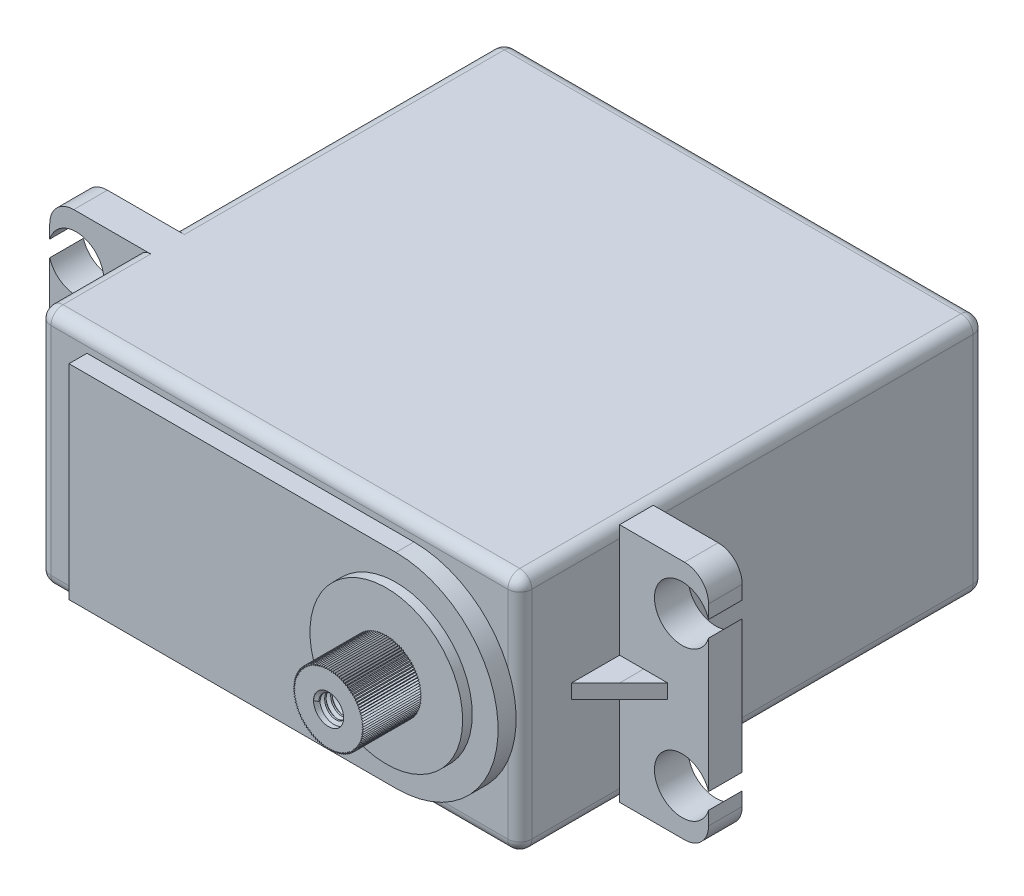
from build123d import *
from build123d.topology import SkipClean

# Parameters (mm, degrees)
SKETCH1_W            = 40
SKETCH1_H            = 20
BOSS_EXTRUDE1_DEPTH  = 38.7
SKETCH2_W            = 2.8
SKETCH2_H            = 20
BOSS_EXTRUDE2_DEPTH  = 7.4
SKETCH3_R            = 2.3
CUT_EXTRUDE1_DEPTH   = 43.129799
FILLET1_R            = 2
RIB5_OUTLINE_W       = 4
RIB5_OUTLINE_H       = 1.2
RIB5_DEPTH           = 4
CUT_EXTRUDE2_DEPTH   = 49.588167
SKETCH6_W            = 3.7
SKETCH6_H            = 6.3
BOSS_EXTRUDE3_DEPTH  = 5
FILLET3_R            = 1
BOSS_EXTRUDE4_DEPTH  = 1.5
SKETCH8_R            = 6.35
BOSS_EXTRUDE5_DEPTH  = 0.8
BOSS_EXTRUDE6_DEPTH  = 4.8
SKETCH10_R           = 1.25
CUT_EXTRUDE3_DEPTH   = 6
THREAD1_PITCH        = 0.5
FILLET1_OF_MIRROR1_R = 2


# Read off the part's stored shape, not the designer's step: Rib5
with BuildPart() as part:
    # Sketch1 → Boss-Extrude1 (new body)
    with BuildSketch(Plane.XY):
        Rectangle(SKETCH1_W, SKETCH1_H)
    extrude(amount=BOSS_EXTRUDE1_DEPTH)

    # Sketch2 → Boss-Extrude2 (add)
    with BuildSketch(Plane.ZY.offset(20)):
        with Locations((29, 0)):
            Rectangle(SKETCH2_W, SKETCH2_H)
    boss_extrude2 = extrude(amount=BOSS_EXTRUDE2_DEPTH)

    # Sketch3 → Cut-Extrude1 (cut, through all)
    with BuildSketch(Plane.XY.offset(30.4)):
        with Locations((-25.2, 6.2)):
            Circle(SKETCH3_R)
        with Locations((-25.2, -6.2)):
            Circle(SKETCH3_R)
    cut_extrude1 = extrude(amount=-CUT_EXTRUDE1_DEPTH, mode=Mode.SUBTRACT)

    # Fillet1
    fillet1_edges = [part.edges().sort_by_distance(p)[0] for p in [
        (-27.4, -10, 29),
        (-27.4, 10, 29),
    ]]
    fillet(fillet1_edges, radius=FILLET1_R)

    # Rib5 outline → Rib5 (add)
    with BuildSketch(Plane.XY.offset(30.4)):
        with Locations((-22, 0)):
            Rectangle(RIB5_OUTLINE_W, RIB5_OUTLINE_H)
    rib5 = extrude(amount=RIB5_DEPTH)

    # Sketch5 → Cut-Extrude2 (cut, through all)
    with BuildSketch(Plane.XZ.offset(0.6)):
        Polygon((-24, 34.4), (-24, 30.4), (-20, 34.4), align=None)
    cut_extrude2 = extrude(amount=-CUT_EXTRUDE2_DEPTH, mode=Mode.SUBTRACT)

    # Sketch6 → Boss-Extrude3 (add)
    with BuildSketch(Plane.ZY.offset(20)):
        with Locations((4.098205, 0)):
            Rectangle(SKETCH6_W, SKETCH6_H)
    extrude(amount=BOSS_EXTRUDE3_DEPTH)

    # Fillet3
    fillet3_edges = [part.edges().sort_by_distance(p)[0] for p in [
        (-20, 0, 5.948205),
        (-22.5, -3.15, 5.948205),
        (-20, 3.15, 4.098205),
        (-22.5, 3.15, 5.948205),
        (-20, 0, 2.248205),
        (-22.5, 3.15, 2.248205),
        (-20, -3.15, 4.098205),
        (-22.5, -3.15, 2.248205),
        (-25, 0, 5.948205),
        (-25, 3.15, 4.098205),
        (-25, 0, 2.248205),
        (-25, -3.15, 4.098205),
        (-20, 0, 38.7),
        (-20, -10, 13.8),
        (-20, 10, 13.8),
        (0, -10, 38.7),
        (20, 0, 38.7),
        (0, -10, 0),
        (-20, 0, 0),
        (0, 10, 0),
        (20, 0, 0),
        (20, -10, 19.35),
        (-20, -10, 34.55),
        (-20, 10, 34.55),
        (20, 10, 19.35),
        (0, 10, 38.7),
    ]]
    fillet(fillet3_edges, radius=FILLET3_R)

    # Sketch7 → Boss-Extrude4 (add)
    with BuildSketch(Plane.XY.offset(38.7)):
        with BuildLine():
            Line((-16, 8.5), (11.194571, 8.5))
            ThreePointArc((11.194571, 8.5), (19.694571, 0), (11.194571, -8.5))
            Line((11.194571, -8.5), (-16, -8.5))
            Line((-16, -8.5), (-16, 8.5))
        make_face()
    extrude(amount=BOSS_EXTRUDE4_DEPTH)

    # Sketch8 → Boss-Extrude5 (add)
    with BuildSketch(Plane.XY.offset(40.2)):
        with Locations((11.194571, 0)):
            Circle(SKETCH8_R)
    extrude(amount=BOSS_EXTRUDE5_DEPTH)

    # Sketch9 → Boss-Extrude6 (add)
    with BuildSketch(Plane.XY.offset(41)):
        Polygon((11.194571, 2.941835), (11.107151, 2.798635), (11.010911, 2.936063), (10.932655, 2.787657), (10.827976, 2.918771), (10.759192, 2.765743), (10.646487, 2.890026), (10.587448, 2.732981), (10.467162, 2.849942), (10.4181, 2.6895), (10.290707, 2.798677), (10.251816, 2.635471), (10.117819, 2.736434), (10.089253, 2.571108), (9.949181, 2.663457), (9.931052, 2.496664), (9.785458, 2.580036), (9.777838, 2.412434), (9.627296, 2.486499), (9.630215, 2.318749), (9.475319, 2.383216), (9.488766, 2.215981), (9.330128, 2.270594), (9.354048, 2.104533), (9.192294, 2.149078), (9.226595, 1.984846), (9.062363, 2.019146), (9.106908, 1.857392), (8.940846, 1.881313), (8.99546, 1.722675), (8.828224, 1.736121), (8.892691, 1.581226), (8.724941, 1.584144), (8.799006, 1.433602), (8.631404, 1.425982), (8.714776, 1.280388), (8.547983, 1.262259), (8.640332, 1.122187), (8.475007, 1.093621), (8.575969, 0.959624), (8.412763, 0.920733), (8.52194, 0.79334), (8.361499, 0.744279), (8.478459, 0.623992), (8.321415, 0.564953), (8.445697, 0.452248), (8.29267, 0.383465), (8.423784, 0.278786), (8.275377, 0.20053), (8.412805, 0.10429), (8.269605, 0.016869), (8.412805, -0.070551), (8.275377, -0.166791), (8.423784, -0.245047), (8.29267, -0.349726), (8.445697, -0.418509), (8.321415, -0.531214), (8.478459, -0.590254), (8.361499, -0.71054), (8.52194, -0.759602), (8.412763, -0.886995), (8.575969, -0.925885), (8.475007, -1.059882), (8.640332, -1.088448), (8.547983, -1.22852), (8.714776, -1.246649), (8.631404, -1.392243), (8.799006, -1.399864), (8.724941, -1.550406), (8.892691, -1.547487), (8.828224, -1.702382), (8.99546, -1.688936), (8.940846, -1.847574), (9.106908, -1.823653), (9.062363, -1.985407), (9.226595, -1.951107), (9.192294, -2.115339), (9.354048, -2.070794), (9.330128, -2.236855), (9.488766, -2.182242), (9.475319, -2.349477), (9.630215, -2.285011), (9.627296, -2.452761), (9.777838, -2.378695), (9.785458, -2.546297), (9.931052, -2.462925), (9.949181, -2.629719), (10.089253, -2.537369), (10.117819, -2.702695), (10.251816, -2.601732), (10.290707, -2.764938), (10.4181, -2.655761), (10.467162, -2.816203), (10.587448, -2.699242), (10.646487, -2.856287), (10.759192, -2.732004), (10.827976, -2.885032), (10.932655, -2.753918), (11.010911, -2.902324), (11.107151, -2.764896), (11.194571, -2.908096), (11.281992, -2.764896), (11.378231, -2.902324), (11.456488, -2.753918), (11.561166, -2.885032), (11.62995, -2.732004), (11.742655, -2.856287), (11.801694, -2.699242), (11.92198, -2.816203), (11.971042, -2.655761), (12.098435, -2.764938), (12.137326, -2.601732), (12.271323, -2.702695), (12.299889, -2.537369), (12.439961, -2.629719), (12.45809, -2.462925), (12.603684, -2.546297), (12.611304, -2.378695), (12.761846, -2.452761), (12.758927, -2.285011), (12.913823, -2.349477), (12.900376, -2.182242), (13.059014, -2.236855), (13.035094, -2.070794), (13.196848, -2.115339), (13.162547, -1.951107), (13.326779, -1.985407), (13.282234, -1.823653), (13.448296, -1.847574), (13.393682, -1.688936), (13.560918, -1.702382), (13.496451, -1.547487), (13.664201, -1.550406), (13.590136, -1.399864), (13.757738, -1.392243), (13.674366, -1.246649), (13.841159, -1.22852), (13.74881, -1.088448), (13.914135, -1.059882), (13.813173, -0.925885), (13.976379, -0.886995), (13.867202, -0.759602), (14.027643, -0.71054), (13.910683, -0.590254), (14.067727, -0.531214), (13.943445, -0.418509), (14.096472, -0.349726), (13.965358, -0.245047), (14.113765, -0.166791), (13.976337, -0.070551), (14.119537, 0.016869), (13.976337, 0.10429), (14.113765, 0.20053), (13.965358, 0.278786), (14.096472, 0.383465), (13.943445, 0.452248), (14.067727, 0.564953), (13.910683, 0.623992), (14.027643, 0.744279), (13.867202, 0.79334), (13.976379, 0.920733), (13.813173, 0.959624), (13.914135, 1.093621), (13.74881, 1.122187), (13.841159, 1.262259), (13.674366, 1.280388), (13.757738, 1.425982), (13.590136, 1.433602), (13.664201, 1.584144), (13.496451, 1.581226), (13.560918, 1.736121), (13.393682, 1.722675), (13.448296, 1.881313), (13.282234, 1.857392), (13.326779, 2.019146), (13.162547, 1.984846), (13.196848, 2.149078), (13.035094, 2.104533), (13.059014, 2.270594), (12.900376, 2.215981), (12.913823, 2.383216), (12.758927, 2.318749), (12.761846, 2.486499), (12.611304, 2.412434), (12.603684, 2.580036), (12.45809, 2.496664), (12.439961, 2.663457), (12.299889, 2.571108), (12.271323, 2.736434), (12.137326, 2.635471), (12.098435, 2.798677), (11.971042, 2.6895), (11.92198, 2.849942), (11.801694, 2.732981), (11.742655, 2.890026), (11.62995, 2.765743), (11.561166, 2.918771), (11.456488, 2.787657), (11.378231, 2.936063), (11.281992, 2.798635), align=None)
    extrude(amount=BOSS_EXTRUDE6_DEPTH)

    # Sketch10 → Cut-Extrude3 (cut)
    with BuildSketch(Plane.XY.offset(45.8)):
        with Locations((11.194571, 0)):
            Circle(SKETCH10_R)
    extrude(amount=-CUT_EXTRUDE3_DEPTH, mode=Mode.SUBTRACT)

    # Thread1: the profile of Thread Profile1 profile screwed along a right-hand helix of 12 turns, 6 arcs to a turn; built about Z, then put on its axis
    with SkipClean():  # the faces are left unmerged after this step: merging them gives an invalid solid
        thread1_z = Axis((0, 0, 0), (0, 0, 1))
        thread1_corners = [(1.2503, 0, -0.000173), (1.2503, 0, 0.437673), (0.979367, 0, 0.28125), (0.979367, 0, 0.15625)]
        with BuildLine(mode=Mode.PRIVATE) as thread1_profile:
            Line(thread1_corners[0], thread1_corners[1])
            Line(thread1_corners[1], thread1_corners[2])
            Line(thread1_corners[2], thread1_corners[3])
            Line(thread1_corners[3], thread1_corners[0])
        thread1_cap = Face(thread1_profile.wire())
        thread1_turn_angles = [0, 30, 60, 90, 120, 150, 180, 210, 240, 270, 300, 330, 360]
        thread1_turn_weights = [1, 0.8660254037844387, 1, 0.8660254037844387, 1, 0.8660254037844387, 1, 0.8660254037844387, 1, 0.8660254037844387, 1, 0.8660254037844387, 1]
        thread1_turn_rails = [Edge.make_bspline([Vector(p[0], p[1], 0).rotate(thread1_z, thread1_turn_angles[k]) / thread1_turn_weights[k] + Vector(0, 0, p[2] + THREAD1_PITCH * thread1_turn_angles[k] / 360) for k in range(13)], [0, 0, 0, 1, 1, 2, 2, 3, 3, 4, 4, 5, 5, 6, 6, 6], 2, thread1_turn_weights) for p in thread1_corners]
        thread1_turn_sides = [Face.make_surface_from_curves(thread1_turn_rails[p[0]], thread1_turn_rails[p[1]]) for p in [(0, 1), (1, 2), (2, 3), (3, 0)]]
        thread1 = Plane(origin=(11.194571, 0, 45.8), x_dir=(-1, 0, 0), z_dir=(0, 0, -1)) * Solid(Shell([*[p.moved(Location((0, 0, THREAD1_PITCH * i))) for i in range(12) for p in thread1_turn_sides], thread1_cap, thread1_cap.rotate(thread1_z, 4320).moved(Location((0, 0, THREAD1_PITCH * 4320 / 360)))]))
        add(thread1)

    # Mirror1: Boss-Extrude2, Cut-Extrude1, Rib5, Cut-Extrude2 across plane
    with SkipClean():  # the faces are left unmerged after this step: merging them gives an invalid solid
        add(boss_extrude2.mirror(Plane(origin=(0, 0, 0), x_dir=(0, 0, 1), z_dir=(1, 0, 0))))
        add(cut_extrude1.mirror(Plane(origin=(0, 0, 0), x_dir=(0, 0, 1), z_dir=(1, 0, 0))), mode=Mode.SUBTRACT)
        add(rib5.mirror(Plane(origin=(0, 0, 0), x_dir=(0, 0, 1), z_dir=(1, 0, 0))))
        add(cut_extrude2.mirror(Plane(origin=(0, 0, 0), x_dir=(0, 0, 1), z_dir=(1, 0, 0))), mode=Mode.SUBTRACT)

    # Fillet1 of Mirror1
    fillet1_of_mirror1_edges = [part.edges().sort_by_distance(p)[0] for p in [
        (27.4, -10, 29),
        (27.4, 10, 29),
    ]]
    fillet(fillet1_of_mirror1_edges, radius=FILLET1_OF_MIRROR1_R)


solid = part.part
